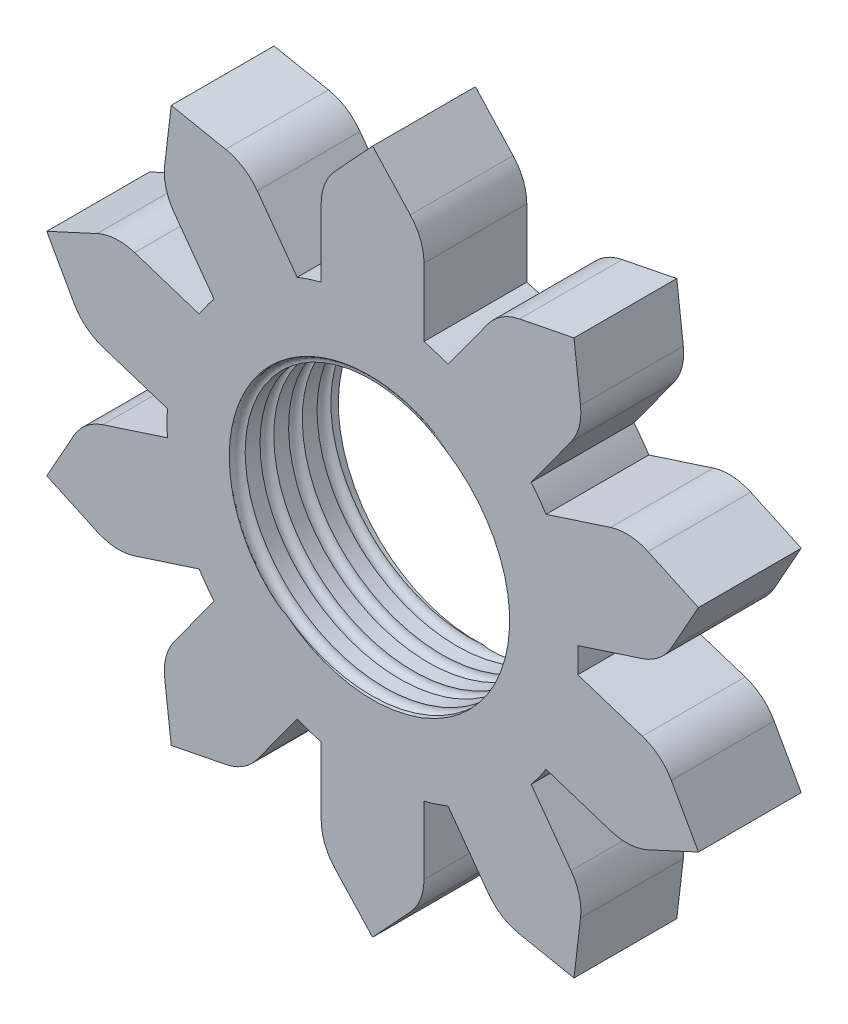
from build123d import *

# Parameters (mm, degrees)
SKETCH1_R           = 4
BOSS_EXTRUDE1_DEPTH = 3
CUT_SWEEP8_PITCH    = 0.8333333


with BuildPart() as part:
    # Sketch1 → Boss-Extrude1 (new body)
    with BuildSketch(Plane.XY):
        with BuildLine():
            Line((1.5, 5.809475019), (1.5, 7.79094154))
            ThreePointArc((1.5, 7.79094154), (1.396739893, 8.337858051), (1.10117644, 8.809475019))
            Line((1.10117644, 8.809475019), (0, 10))
            Line((0, 10), (-1.10117644, 8.809475019))
            ThreePointArc((-1.10117644, 8.809475019), (-1.396739893, 8.337858051), (-1.5, 7.79094154))
            Line((-1.5, 7.79094154), (-1.5, 5.809475019))
            ThreePointArc((-1.5, 5.809475019), (-1.854101966, 5.706339098), (-2.201198248, 5.581641897))
            Line((-2.201198248, 5.581641897), (-3.365875047, 7.184681986))
            ThreePointArc((-3.365875047, 7.184681986), (-3.770883688, 7.566451971), (-4.287209043, 7.774270273))
            Line((-4.287209043, 7.774270273), (-5.877852523, 8.090169944))
            Line((-5.877852523, 8.090169944), (-6.06894995, 6.479759731))
            ThreePointArc((-6.06894995, 6.479759731), (-6.030856309, 5.924485749), (-5.79292603, 5.421326229))
            Line((-5.79292603, 5.421326229), (-4.628249231, 3.818286141))
            ThreePointArc((-4.628249231, 3.818286141), (-4.854101966, 3.526711514), (-5.061613582, 3.221811284))
            Line((-5.061613582, 3.221811284), (-6.946100228, 3.834118112))
            ThreePointArc((-6.946100228, 3.834118112), (-7.498157868, 3.904918412), (-8.038026389, 3.769558521))
            Line((-8.038026389, 3.769558521), (-9.510565163, 3.090169944))
            Line((-9.510565163, 3.090169944), (-8.718590856, 1.674996464))
            ThreePointArc((-8.718590856, 1.674996464), (-8.361390595, 1.248161257), (-7.873151211, 0.980948564))
            Line((-7.873151211, 0.980948564), (-5.988664565, 0.368641735))
            ThreePointArc((-5.988664565, 0.368641735), (-6, 0), (-5.988664565, -0.368641735))
            Line((-5.988664565, -0.368641735), (-7.873151211, -0.980948564))
            ThreePointArc((-7.873151211, -0.980948564), (-8.361390595, -1.248161257), (-8.718590856, -1.674996464))
            Line((-8.718590856, -1.674996464), (-9.510565163, -3.090169944))
            Line((-9.510565163, -3.090169944), (-8.038026389, -3.769558521))
            ThreePointArc((-8.038026389, -3.769558521), (-7.498157868, -3.904918412), (-6.946100228, -3.834118112))
            Line((-6.946100228, -3.834118112), (-5.061613582, -3.221811284))
            ThreePointArc((-5.061613582, -3.221811284), (-4.854101966, -3.526711514), (-4.628249231, -3.818286141))
            Line((-4.628249231, -3.818286141), (-5.79292603, -5.421326229))
            ThreePointArc((-5.79292603, -5.421326229), (-6.030856309, -5.924485749), (-6.06894995, -6.479759731))
            Line((-6.06894995, -6.479759731), (-5.877852523, -8.090169944))
            Line((-5.877852523, -8.090169944), (-4.287209043, -7.774270273))
            ThreePointArc((-4.287209043, -7.774270273), (-3.770883688, -7.566451971), (-3.365875047, -7.184681986))
            Line((-3.365875047, -7.184681986), (-2.201198248, -5.581641897))
            ThreePointArc((-2.201198248, -5.581641897), (-1.854101966, -5.706339098), (-1.5, -5.809475019))
            Line((-1.5, -5.809475019), (-1.5, -7.79094154))
            ThreePointArc((-1.5, -7.79094154), (-1.396739893, -8.337858051), (-1.10117644, -8.809475019))
            Line((-1.10117644, -8.809475019), (0, -10))
            Line((0, -10), (1.10117644, -8.809475019))
            ThreePointArc((1.10117644, -8.809475019), (1.396739893, -8.337858051), (1.5, -7.79094154))
            Line((1.5, -7.79094154), (1.5, -5.809475019))
            ThreePointArc((1.5, -5.809475019), (1.854101966, -5.706339098), (2.201198248, -5.581641897))
            Line((2.201198248, -5.581641897), (3.365875047, -7.184681986))
            ThreePointArc((3.365875047, -7.184681986), (3.770883688, -7.566451971), (4.287209043, -7.774270273))
            Line((4.287209043, -7.774270273), (5.877852523, -8.090169944))
            Line((5.877852523, -8.090169944), (6.06894995, -6.479759731))
            ThreePointArc((6.06894995, -6.479759731), (6.030856309, -5.924485749), (5.79292603, -5.421326229))
            Line((5.79292603, -5.421326229), (4.628249231, -3.818286141))
            ThreePointArc((4.628249231, -3.818286141), (4.854101966, -3.526711514), (5.061613582, -3.221811284))
            Line((5.061613582, -3.221811284), (6.946100228, -3.834118112))
            ThreePointArc((6.946100228, -3.834118112), (7.498157868, -3.904918412), (8.038026389, -3.769558521))
            Line((8.038026389, -3.769558521), (9.510565163, -3.090169944))
            Line((9.510565163, -3.090169944), (8.718590856, -1.674996464))
            ThreePointArc((8.718590856, -1.674996464), (8.361390595, -1.248161257), (7.873151211, -0.980948564))
            Line((7.873151211, -0.980948564), (5.988664565, -0.368641735))
            ThreePointArc((5.988664565, -0.368641735), (6, 0), (5.988664565, 0.368641735))
            Line((5.988664565, 0.368641735), (7.873151211, 0.980948564))
            ThreePointArc((7.873151211, 0.980948564), (8.361390595, 1.248161257), (8.718590856, 1.674996464))
            Line((8.718590856, 1.674996464), (9.510565163, 3.090169944))
            Line((9.510565163, 3.090169944), (8.038026389, 3.769558521))
            ThreePointArc((8.038026389, 3.769558521), (7.498157868, 3.904918412), (6.946100228, 3.834118112))
            Line((6.946100228, 3.834118112), (5.061613582, 3.221811284))
            ThreePointArc((5.061613582, 3.221811284), (4.854101966, 3.526711514), (4.628249231, 3.818286141))
            Line((4.628249231, 3.818286141), (5.79292603, 5.421326229))
            ThreePointArc((5.79292603, 5.421326229), (6.030856309, 5.924485749), (6.06894995, 6.479759731))
            Line((6.06894995, 6.479759731), (5.877852523, 8.090169944))
            Line((5.877852523, 8.090169944), (4.287209043, 7.774270273))
            ThreePointArc((4.287209043, 7.774270273), (3.770883688, 7.566451971), (3.365875047, 7.184681986))
            Line((3.365875047, 7.184681986), (2.201198248, 5.581641897))
            ThreePointArc((2.201198248, 5.581641897), (1.854101966, 5.706339098), (1.5, 5.809475019))
        make_face()
        Circle(SKETCH1_R, mode=Mode.SUBTRACT)
    extrude(amount=BOSS_EXTRUDE1_DEPTH)

    # Cut-Sweep8: arcs per turn and ends read off the stored shape
    # Cut-Sweep8: the profile of Sketch4 screwed along a left-hand helix through 4.75 turns, 8 arcs to a turn; built about Z, then put on its axis
    cut_sweep8_z = Axis((0, 0, 0), (0, 0, 1))
    cut_sweep8_corners = [(4, 0, -0.199999999), (3.8, 0, 1e-09), (4, 0, 0.200000001), (4.2, 0, 1e-09)]
    with BuildLine(mode=Mode.PRIVATE) as cut_sweep8_profile:
        ThreePointArc((4, 0, -0.199999999), (3.858578644, 0, -0.141421355), (3.8, 0, 1e-09))
        ThreePointArc((3.8, 0, 1e-09), (3.858578644, 0, 0.141421357), (4, 0, 0.200000001))
        ThreePointArc((4, 0, 0.200000001), (4.141421356, 0, 0.141421357), (4.2, 0, 1e-09))
        ThreePointArc((4.2, 0, 1e-09), (4.141421356, 0, -0.141421355), (4, 0, -0.199999999))
    cut_sweep8_cap = Face(cut_sweep8_profile.wire())
    cut_sweep8_arcs = [((4, 0, -0.199999999), (3.8, 0, -0.199999999), (3.8, 0, 1e-09), (1, 0.7071067811865476, 1)), ((3.8, 0, 1e-09), (3.8, 0, 0.200000001), (4, 0, 0.200000001), (1, 0.7071067811865476, 1)), ((4, 0, 0.200000001), (4.2, 0, 0.200000001), (4.2, 0, 1e-09), (1, 0.7071067811865476, 1)), ((4.2, 0, 1e-09), (4.2, 0, -0.199999999), (4, 0, -0.199999999), (1, 0.7071067811865476, 1))]  # start, shoulder, end, weights
    cut_sweep8_turn_angles = [0, -22.5, -45, -67.5, -90, -112.5, -135, -157.5, -180, -202.5, -225, -247.5, -270, -292.5, -315, -337.5, -360]
    cut_sweep8_turn_weights = [1, 0.9238795325112867, 1, 0.9238795325112867, 1, 0.9238795325112867, 1, 0.9238795325112867, 1, 0.9238795325112867, 1, 0.9238795325112867, 1, 0.9238795325112867, 1, 0.9238795325112867, 1]
    cut_sweep8_turn_sides = [Face.make_bezier_surface([[Vector(p[j][0], p[j][1], 0).rotate(cut_sweep8_z, cut_sweep8_turn_angles[2 * i + k]) / cut_sweep8_turn_weights[2 * i + k] + Vector(0, 0, p[j][2] + -CUT_SWEEP8_PITCH * cut_sweep8_turn_angles[2 * i + k] / 360) for k in range(3)] for j in range(3)], [[p[3][j] * cut_sweep8_turn_weights[2 * i + k] for k in range(3)] for j in range(3)]) for p in cut_sweep8_arcs for i in range(8)]
    cut_sweep8_last_angles = [-1440, -1462.5, -1485, -1507.5, -1530, -1552.5, -1575, -1597.5, -1620, -1642.5, -1665, -1687.5, -1710]
    cut_sweep8_last_weights = [1, 0.9238795325112867, 1, 0.9238795325112867, 1, 0.9238795325112867, 1, 0.9238795325112867, 1, 0.9238795325112867, 1, 0.9238795325112761, 1]
    cut_sweep8_last_sides = [Face.make_bezier_surface([[Vector(p[j][0], p[j][1], 0).rotate(cut_sweep8_z, cut_sweep8_last_angles[2 * i + k]) / cut_sweep8_last_weights[2 * i + k] + Vector(0, 0, p[j][2] + -CUT_SWEEP8_PITCH * cut_sweep8_last_angles[2 * i + k] / 360) for k in range(3)] for j in range(3)], [[p[3][j] * cut_sweep8_last_weights[2 * i + k] for k in range(3)] for j in range(3)]) for p in cut_sweep8_arcs for i in range(6)]
    cut_sweep8 = Plane(origin=(0, 0, 0), x_dir=(1, 0, 0), z_dir=(0, 0, 1)) * Solid(Shell([*[p.moved(Location((0, 0, CUT_SWEEP8_PITCH * i))) for i in range(4) for p in cut_sweep8_turn_sides], *cut_sweep8_last_sides, cut_sweep8_cap, cut_sweep8_cap.rotate(cut_sweep8_z, -1710).moved(Location((0, 0, -CUT_SWEEP8_PITCH * -1710 / 360)))]))
    add(cut_sweep8, mode=Mode.SUBTRACT)


solid = part.part
